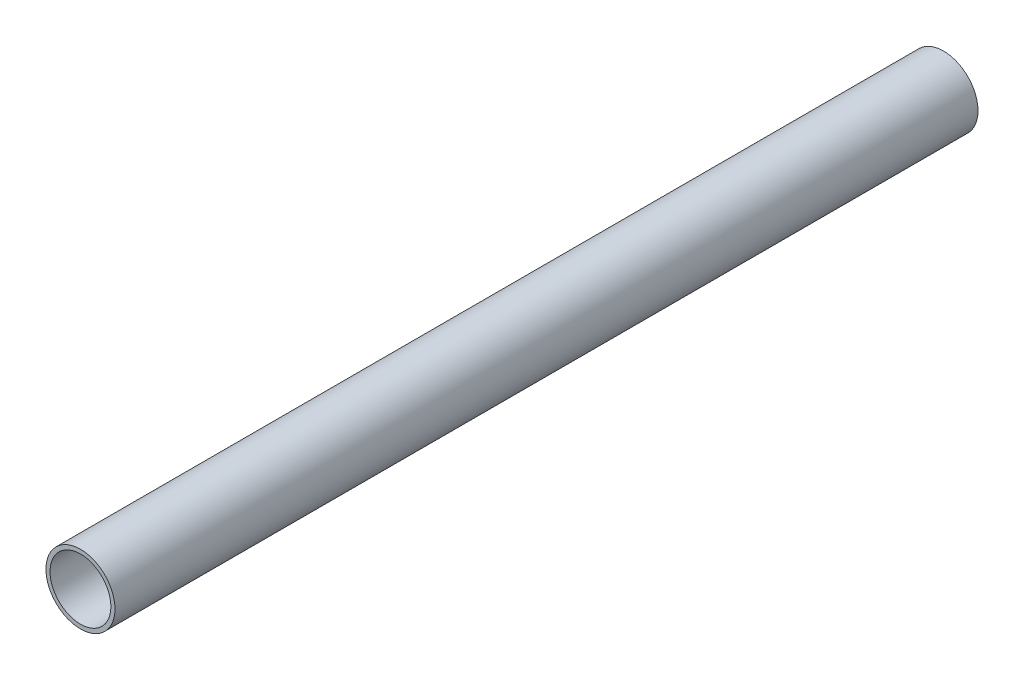
from build123d import *

# Parameters (mm, degrees)
PIPESKETCH_R    = 16
PIPESKETCH_R_2  = 14.1
EXTRUSION_DEPTH = 400


with BuildPart() as part:
    # PipeSketch → Extrusion (new body)
    with BuildSketch(Plane.XY):
        Circle(PIPESKETCH_R)
        Circle(PIPESKETCH_R_2, mode=Mode.SUBTRACT)
    extrude(amount=EXTRUSION_DEPTH)


solid = part.part
